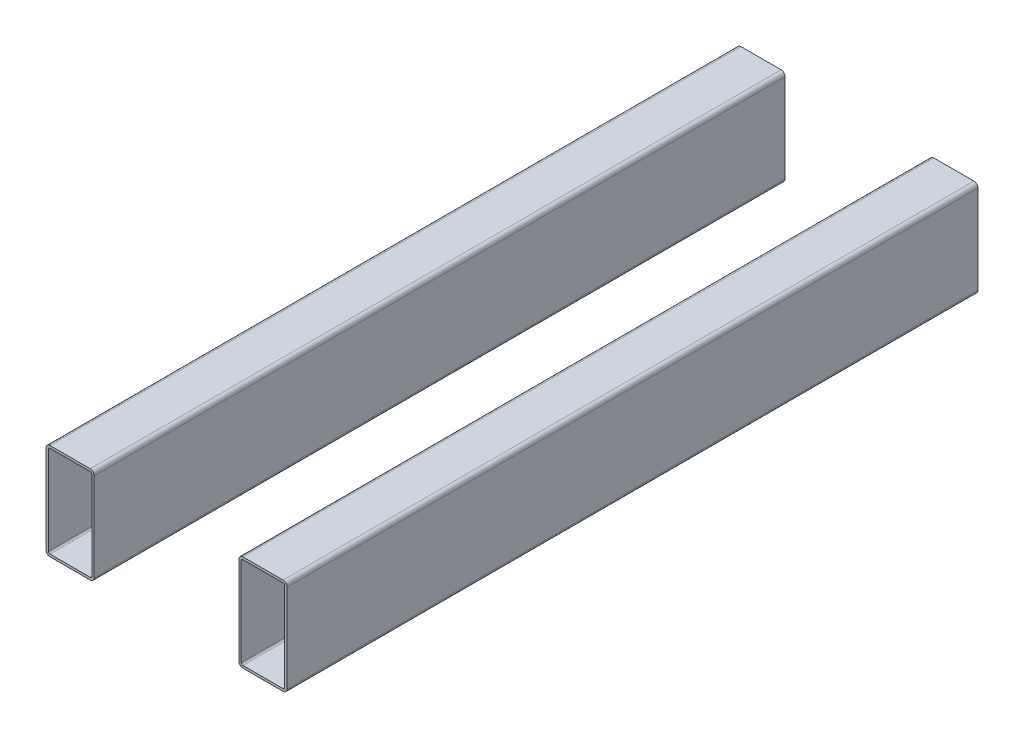
from build123d import *

# Parameters (mm, degrees)
BOSS_EXTRUDE3_DEPTH        = 430
BOSS_EXTRUDE3_DEPTH_BACK   = 430
SKETCH1_W                  = 60
SKETCH1_H                  = 120
BOSS_EXTRUDE3_2_DEPTH      = 430
BOSS_EXTRUDE3_2_DEPTH_BACK = 430
FILLET1_R                  = 5
FILLET2_R                  = 5
SHELL4_START               = -427
SHELL4_DEPTH               = 854
SHELL5_START               = -427
SHELL5_DEPTH               = 854
CUT_EXTRUDE1_DEPTH         = 1662.774954679


# Read off the part's stored shape, not the designer's step: Shell4, Shell5
with BuildPart() as part:
    # Sketch1 → Boss-Extrude3 (new, two sides: drawn at the far end of the back side and taken through both)
    with BuildSketch(Plane.XY.offset(-BOSS_EXTRUDE3_DEPTH_BACK)):
        with Locations((120, -1354)):
            Rectangle(SKETCH1_W, SKETCH1_H)
    extrude(amount=BOSS_EXTRUDE3_DEPTH + BOSS_EXTRUDE3_DEPTH_BACK)

    # Fillet1
    fillet1_edges = [part.edges().sort_by_distance(p)[0] for p in [
        (150, -1294, 0),
        (90, -1294, 0),
        (90, -1414, 0),
        (150, -1414, 0),
    ]]
    fillet(fillet1_edges, radius=FILLET1_R)

    # Shell4 outline → Shell4 (cut)
    with BuildSketch(Plane.XY.offset(SHELL4_START)):
        with BuildLine():
            ThreePointArc((147, -1299), (146.414213562, -1297.585786438), (145, -1297))
            Line((145, -1297), (95, -1297))
            ThreePointArc((95, -1297), (93.585786438, -1297.585786438), (93, -1299))
            Line((93, -1299), (93, -1409))
            ThreePointArc((93, -1409), (93.585786438, -1410.414213562), (95, -1411))
            Line((95, -1411), (145, -1411))
            ThreePointArc((145, -1411), (146.414213562, -1410.414213562), (147, -1409))
            Line((147, -1409), (147, -1299))
        make_face()
    extrude(amount=SHELL4_DEPTH, mode=Mode.SUBTRACT)


with BuildPart() as body_2:
    # Sketch1 → Boss-Extrude3 2 (new, two sides: drawn at the far end of the back side and taken through both)
    with BuildSketch(Plane.XY.offset(-BOSS_EXTRUDE3_2_DEPTH_BACK)):
        with Locations((-120, -1354)):
            Rectangle(SKETCH1_W, SKETCH1_H)
    extrude(amount=BOSS_EXTRUDE3_2_DEPTH + BOSS_EXTRUDE3_2_DEPTH_BACK)

    # Fillet2
    fillet2_edges = [body_2.edges().sort_by_distance(p)[0] for p in [
        (-150, -1294, 0),
        (-150, -1414, 0),
        (-90, -1414, 0),
        (-90, -1294, 0),
    ]]
    fillet(fillet2_edges, radius=FILLET2_R)

    # Shell5 outline → Shell5 (cut)
    with BuildSketch(Plane.XY.offset(SHELL5_START)):
        with BuildLine():
            ThreePointArc((-145, -1297), (-146.414213562, -1297.585786438), (-147, -1299))
            Line((-147, -1299), (-147, -1409))
            ThreePointArc((-147, -1409), (-146.414213562, -1410.414213562), (-145, -1411))
            Line((-145, -1411), (-95, -1411))
            ThreePointArc((-95, -1411), (-93.585786438, -1410.414213562), (-93, -1409))
            Line((-93, -1409), (-93, -1299))
            ThreePointArc((-93, -1299), (-93.585786438, -1297.585786438), (-95, -1297))
            Line((-95, -1297), (-145, -1297))
        make_face()
    extrude(amount=SHELL5_DEPTH, mode=Mode.SUBTRACT)


with BuildPart() as cut_extrude1_tool:
    # Sketch2 → Cut-Extrude1 (new, through all)
    with BuildSketch(Plane(origin=(0, 0, -430), x_dir=(-1, 0, 0), z_dir=(0, 0, -1))):
        with BuildLine():
            Line((-145, -1411), (-95, -1411))
            ThreePointArc((-95, -1411), (-93.585786438, -1410.414213562), (-93, -1409))
            Line((-93, -1409), (-93, -1299))
            ThreePointArc((-93, -1299), (-93.585786438, -1297.585786438), (-95, -1297))
            Line((-95, -1297), (-145, -1297))
            ThreePointArc((-145, -1297), (-146.414213562, -1297.585786438), (-147, -1299))
            Line((-147, -1299), (-147, -1409))
            ThreePointArc((-147, -1409), (-146.414213562, -1410.414213562), (-145, -1411))
        make_face()
        with BuildLine():
            Line((95, -1411), (145, -1411))
            ThreePointArc((145, -1411), (146.414213562, -1410.414213562), (147, -1409))
            Line((147, -1409), (147, -1299))
            ThreePointArc((147, -1299), (146.414213562, -1297.585786438), (145, -1297))
            Line((145, -1297), (95, -1297))
            ThreePointArc((95, -1297), (93.585786438, -1297.585786438), (93, -1299))
            Line((93, -1299), (93, -1409))
            ThreePointArc((93, -1409), (93.585786438, -1410.414213562), (95, -1411))
        make_face()
    extrude(amount=-CUT_EXTRUDE1_DEPTH)


with BuildPart() as part_1:
    add(part.part)

    # Cut-Extrude1: cut by cut_extrude1_tool
    add(cut_extrude1_tool.part, mode=Mode.SUBTRACT)


with BuildPart() as body_2_1:
    add(body_2.part)

    # Cut-Extrude1: cut by cut_extrude1_tool
    add(cut_extrude1_tool.part, mode=Mode.SUBTRACT)


solid = Compound([part_1.part, body_2_1.part])
